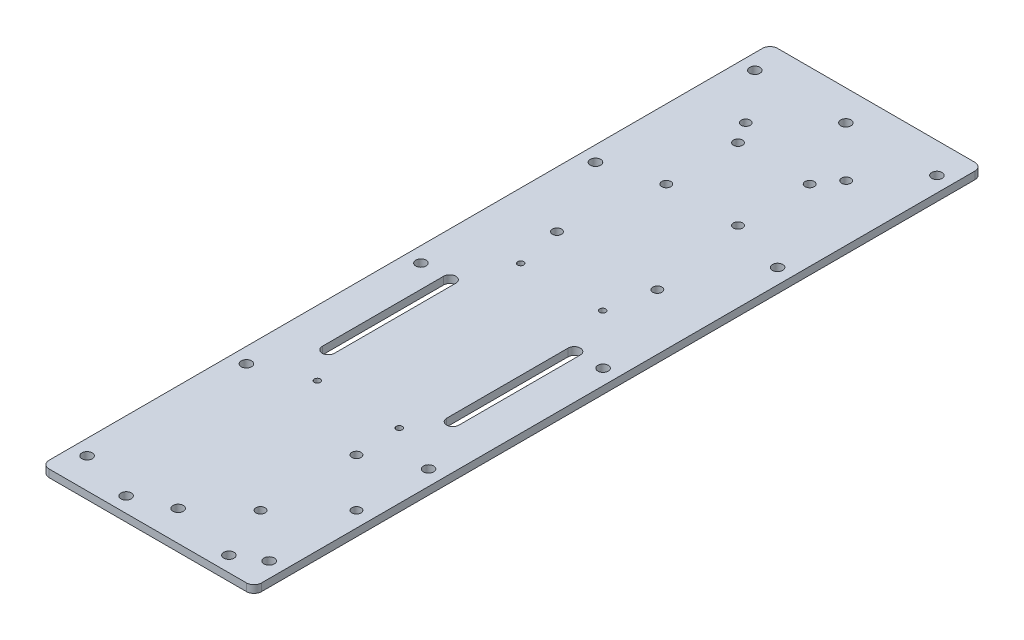
from build123d import *

# Parameters (mm, degrees)
PLATE_THICKNESS_DEPTH        = 3.175
SKETCH3_R                    = 2.159
MOUNTING_HOLES_DEPTH         = 159.781746826
SKETCH4_R                    = 1.905
JETSON_HOLES_W_O_MOUNT_DEPTH = 159.781746826
SKETCH5_R                    = 1.905
PDB_HOLES_DEPTH              = 159.781746826
SKETCH6_R                    = 1.905
LIDAR_HOLES_DEPTH            = 159.781746826
SKETCH7_R                    = 1.27
PIXHAWK_HOLES_DEPTH          = 159.781746826
BATTERY_HOLES_DEPTH          = 159.781746826
SKETCH9_R                    = 2.159
STEREO_CAM_DEPTH             = 159.781746826


with BuildPart() as part:
    # Sketch2 → Plate Thickness (new body)
    with BuildSketch(Plane(origin=(0, 0, 0), x_dir=(1, 0, 0), z_dir=(0, 1, 0))):
        with BuildLine():
            Line((-41.275, 152.4), (41.275, 152.4))
            ThreePointArc((41.275, 152.4), (43.52006403, 151.47006403), (44.45, 149.225))
            Line((44.45, 149.225), (44.45, -149.225))
            ThreePointArc((44.45, -149.225), (43.52006403, -151.47006403), (41.275, -152.4))
            Line((41.275, -152.4), (-41.275, -152.4))
            ThreePointArc((-41.275, -152.4), (-43.52006403, -151.47006403), (-44.45, -149.225))
            Line((-44.45, -149.225), (-44.45, 149.225))
            ThreePointArc((-44.45, 149.225), (-43.52006403, 151.47006403), (-41.275, 152.4))
        make_face()
    extrude(amount=PLATE_THICKNESS_DEPTH)

    # Sketch3 → Mounting holes (cut, through all)
    with BuildSketch(Plane(origin=(0, 3.175, 0), x_dir=(1, 0, 0), z_dir=(0, 1, 0))):
        with Locations((-38.1, 139.7)):
            Circle(SKETCH3_R)
        with Locations((-38.1, 73.025)):
            Circle(SKETCH3_R)
        with Locations((-38.1, -73.025)):
            Circle(SKETCH3_R)
        with Locations((-38.1, -139.7)):
            Circle(SKETCH3_R)
        with Locations((38.1, -139.7)):
            Circle(SKETCH3_R)
        with Locations((38.1, -73.025)):
            Circle(SKETCH3_R)
        with Locations((38.1, 73.025)):
            Circle(SKETCH3_R)
        with Locations((38.1, 139.7)):
            Circle(SKETCH3_R)
        with Locations((0, 139.7)):
            Circle(SKETCH3_R)
        with Locations((0, -139.7)):
            Circle(SKETCH3_R)
        with Locations((-38.1, 0)):
            Circle(SKETCH3_R)
        with Locations((38.1, 0)):
            Circle(SKETCH3_R)
    extrude(amount=-MOUNTING_HOLES_DEPTH, mode=Mode.SUBTRACT)

    # Sketch4 → Jetson Holes (w/o mount) (cut, through all)
    with BuildSketch(Plane(origin=(0, 3.175, 0), x_dir=(1, 0, 0), z_dir=(0, 1, 0))):
        with Locations((-21.0058, 118.808268359)):
            Circle(SKETCH4_R)
        with Locations((-21.0058, 39.814268359)):
            Circle(SKETCH4_R)
        with Locations((21.0058, 39.814268359)):
            Circle(SKETCH4_R)
        with Locations((21.0058, 118.808268359)):
            Circle(SKETCH4_R)
    extrude(amount=-JETSON_HOLES_W_O_MOUNT_DEPTH, mode=Mode.SUBTRACT)

    # Sketch5 → PDB holes (cut, through all)
    with BuildSketch(Plane(origin=(0, 3.175, 0), x_dir=(1, 0, 0), z_dir=(0, 1, 0))):
        with Locations((-15.378405846, 109.933938224)):
            Circle(SKETCH5_R)
        with Locations((14.618994154, 109.933938224)):
            Circle(SKETCH5_R)
        with Locations((14.618994154, 79.936538224)):
            Circle(SKETCH5_R)
        with Locations((-15.378405846, 79.936538224)):
            Circle(SKETCH5_R)
    extrude(amount=-PDB_HOLES_DEPTH, mode=Mode.SUBTRACT)

    # Sketch6 → Lidar Holes (cut, through all)
    with BuildSketch(Plane(origin=(0, 3.175, 0), x_dir=(1, 0, 0), z_dir=(0, 1, 0))):
        with Locations((38.003189405, -103.082806339)):
            Circle(SKETCH6_R)
        with Locations((17.937189405, -83.016806339)):
            Circle(SKETCH6_R)
        with Locations((17.937189405, -123.148806339)):
            Circle(SKETCH6_R)
    extrude(amount=-LIDAR_HOLES_DEPTH, mode=Mode.SUBTRACT)

    # Sketch7 → PixHawk Holes (cut, through all)
    with BuildSketch(Plane(origin=(0, 3.175, 0), x_dir=(1, 0, 0), z_dir=(0, 1, 0))):
        with Locations((-17.145, 20.769931445)):
            Circle(SKETCH7_R)
        with Locations((-17.145, -64.320068555)):
            Circle(SKETCH7_R)
        with Locations((17.145, -64.320068555)):
            Circle(SKETCH7_R)
        with Locations((17.145, 20.769931445)):
            Circle(SKETCH7_R)
    extrude(amount=-PIXHAWK_HOLES_DEPTH, mode=Mode.SUBTRACT)

    # Sketch8 → Battery Holes (cut, through all)
    with BuildSketch(Plane(origin=(0, 3.175, 0), x_dir=(1, 0, 0), z_dir=(0, 1, 0))):
        with BuildLine():
            Line((-23.495, -0.005964701), (-23.495, -50.805964701))
            ThreePointArc((-23.495, -50.805964701), (-26.035, -53.345964701), (-28.575, -50.805964701))
            Line((-28.575, -50.805964701), (-28.575, -0.005964701))
            ThreePointArc((-28.575, -0.005964701), (-26.035, 2.534035299), (-23.495, -0.005964701))
        make_face()
        with BuildLine():
            Line((23.495, -0.005964701), (23.495, -50.805964701))
            ThreePointArc((23.495, -50.805964701), (26.035, -53.345964701), (28.575, -50.805964701))
            Line((28.575, -50.805964701), (28.575, -0.005964701))
            ThreePointArc((28.575, -0.005964701), (26.035, 2.534035299), (23.495, -0.005964701))
        make_face()
    extrude(amount=-BATTERY_HOLES_DEPTH, mode=Mode.SUBTRACT)

    # Sketch9 → Stereo Cam (cut, through all)
    with BuildSketch(Plane(origin=(0, 3.175, 0), x_dir=(1, 0, 0), z_dir=(0, 1, 0))):
        with Locations((-15.40764, -146.05)):
            Circle(SKETCH9_R)
        with Locations((27.59202, -146.05)):
            Circle(SKETCH9_R)
    extrude(amount=-STEREO_CAM_DEPTH, mode=Mode.SUBTRACT)


solid = part.part
